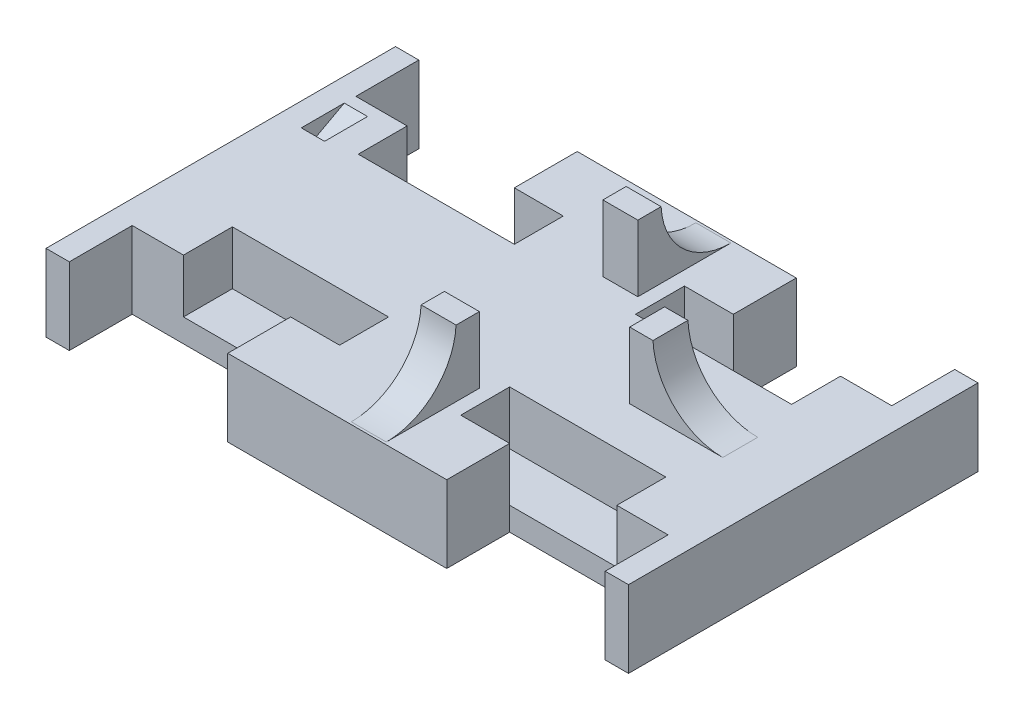
from build123d import *

# Parameters (mm, degrees)
SKETCH2_W                = 10
SKETCH2_H                = 86
BOSS_EXTRUDE1_DEPTH      = 10
SKETCH3_W                = 10
SKETCH3_H                = 86
BOSS_EXTRUDE2_DEPTH      = 23
BOSS_EXTRUDE3_REACH      = 246.16
BOSS_EXTRUDE4_DEPTH      = 100
BOSS_EXTRUDE4_DEPTH_BACK = 5
SKETCH5_R                = 47.55
SKETCH7_W                = 10
SKETCH7_H                = 18.447060317
BOSS_EXTRUDE6_DEPTH      = 30
CUT_EXTRUDE2_DEPTH       = 10
BOSS_EXTRUDE7_REACH      = 275.742
SKETCH6_R                = 45.55
CUT_EXTRUDE1_DEPTH       = 100
SKETCH10_W               = 15
SKETCH10_H               = 10
SKETCH10_W_2             = 10
SKETCH10_H_2             = 15
BOSS_EXTRUDE8_DEPTH      = 28.5
FILLET1_R                = 30
FILLET2_R                = 30
FILLET3_R                = 30
SKETCH11_W               = 111.971085125
SKETCH11_H               = 99.425275067
CUT_EXTRUDE3_DEPTH       = 234.52646531


with BuildPart() as part:
    # Sketch2 → Boss-Extrude1 (new body)
    with BuildSketch(Plane(origin=(0, 0, 0), x_dir=(1, 0, 0), z_dir=(0, 1, 0))):
        Polygon((-125, -75), (-115, -75), (-115, -48), (-47, -48), (-47, -75), (47, -75), (47, -48), (115, -48), (115, -75), (125, -75), (125, 75), (115, 75), (115, 48), (47, 48), (47, 75), (-47, 75), (-47, 48), (-115, 48), (-115, 75), (-125, 75), align=None)
        with Locations((-110, 0)):
            Rectangle(SKETCH2_W, SKETCH2_H, mode=Mode.SUBTRACT)
    extrude(amount=BOSS_EXTRUDE1_DEPTH)

    # Sketch3 → Boss-Extrude2 (add)
    with BuildSketch(Plane(origin=(0, 10, 0), x_dir=(1, 0, 0), z_dir=(0, 1, 0))):
        Polygon((-47, 48), (-47, 75), (47, 75), (47, 48), (26, 48), (26, 27), (93, 27), (93, 48), (115, 48), (115, 75), (125, 75), (125, -75), (115, -75), (115, -48), (93, -48), (93, -27), (26, -27), (26, -48), (47, -48), (47, -75), (-47, -75), (-47, -48), (-26, -48), (-26, -27), (-93, -27), (-93, -48), (-115, -48), (-115, -75), (-125, -75), (-125, 75), (-115, 75), (-115, 48), (-93, 48), (-93, 27), (-26, 27), (-26, 48), align=None)
        with Locations((-110, 0)):
            Rectangle(SKETCH3_W, SKETCH3_H, mode=Mode.SUBTRACT)
    extrude(amount=BOSS_EXTRUDE2_DEPTH)

    # Sketch4 → Boss-Extrude3 (add, up to next)
    with BuildSketch(Plane.ZY.offset(105), mode=Mode.PRIVATE) as boss_extrude3_sk1:
        Polygon((-43, 0), (-9.223530158, 14.703891082), (-43, 33), align=None)
    boss_extrude3_tool1 = extrude(boss_extrude3_sk1.sketch, amount=BOSS_EXTRUDE3_REACH, mode=Mode.PRIVATE) - part.part
    # Sketch4 → Boss-Extrude3 (add, up to next)
    with BuildSketch(Plane.ZY.offset(105), mode=Mode.PRIVATE) as boss_extrude3_sk2:
        Polygon((43, 0), (9.223530158, 14.703891082), (-24.552939683, 33), (43, 33), align=None)
    boss_extrude3_tool2 = extrude(boss_extrude3_sk2.sketch, amount=BOSS_EXTRUDE3_REACH, mode=Mode.PRIVATE) - part.part
    add(boss_extrude3_tool1.solids().sort_by_distance((-105, 15.901297, -31.741177))[0])
    add(boss_extrude3_tool2.solids().sort_by_distance((-105, 21.685197, 19.901194))[0])



with BuildPart() as body_2:
    # Sketch5 → Boss-Extrude4 (new, two sides: drawn at the far end of the back side and taken through both)
    with BuildSketch(Plane(origin=(-115, 0, 0), x_dir=(0, 0, -1), z_dir=(1, 0, 0)).offset(-BOSS_EXTRUDE4_DEPTH_BACK)):
        with Locations((0, 80.55)):
            Circle(SKETCH5_R)
    extrude(amount=BOSS_EXTRUDE4_DEPTH + BOSS_EXTRUDE4_DEPTH_BACK)


with BuildPart() as part_1:
    add(part.part)

    add(body_2.part)  # Boss-Extrude6 merges body 2
    # Sketch7 → Boss-Extrude6 (add)
    with BuildSketch(Plane(origin=(0, 33, 0), x_dir=(1, 0, 0), z_dir=(0, 1, 0))):
        Polygon((-120, 0), (-120, 48), (-93, 48), (-93, 27), (-15, 27), (-15, -27), (-93, -27), (-93, -48), (-120, -48), align=None)
        with Locations((-110, 33.776469842)):
            Rectangle(SKETCH7_W, SKETCH7_H, mode=Mode.SUBTRACT)
    extrude(amount=BOSS_EXTRUDE6_DEPTH)

    # Sketch8 → Cut-Extrude2 (cut)
    with BuildSketch(Plane.ZY.offset(105)):
        Polygon((-43, 46.626077643), (-41.871641374, 62.212018017), (-24.552939683, 62.212018017), (-24.552939683, 33), (-43, 33), align=None)
    extrude(amount=CUT_EXTRUDE2_DEPTH, mode=Mode.SUBTRACT)

    # Sketch9 → Boss-Extrude7 (add, up to next)
    with BuildSketch(Plane.ZY.offset(105), mode=Mode.PRIVATE) as boss_extrude7_sk1:
        Polygon((-42.138917347, 58.520153318), (-43, 46.626077643), (-43, 62.212018017), (-41.871641374, 62.212018017), align=None)
    boss_extrude7_tool1 = extrude(boss_extrude7_sk1.sketch, amount=BOSS_EXTRUDE7_REACH, mode=Mode.PRIVATE) - part_1.part
    add(boss_extrude7_tool1.solids().sort_by_distance((-105, 57.016705, -42.62388))[0])

    # Sketch6 → Cut-Extrude1 (cut)
    with BuildSketch(Plane(origin=(-15, 0, 0), x_dir=(0, 0, -1), z_dir=(1, 0, 0))):
        with Locations((0, 80.55)):
            Circle(SKETCH6_R)
    extrude(amount=-CUT_EXTRUDE1_DEPTH, mode=Mode.SUBTRACT)

    # Sketch10 → Boss-Extrude8 (add)
    with BuildSketch(Plane(origin=(0, 33, 0), x_dir=(1, 0, 0), z_dir=(0, 1, 0))):
        with Locations((12.5, 39)):
            Rectangle(SKETCH10_W, SKETCH10_H)
        with Locations((12.5, -39)):
            Rectangle(SKETCH10_W, SKETCH10_H)
        with Locations((63, 0)):
            Rectangle(SKETCH10_W_2, SKETCH10_H_2)
    extrude(amount=BOSS_EXTRUDE8_DEPTH)

    # Fillet1
    # the kernel refuses this fillet: 30 mm, written as the material it adds along each edge
    with BuildSketch(Plane(origin=(5, 33, 44), x_dir=(0, 0, 1), z_dir=(1, 0, 0))) as fillet1_piece_1:
        with BuildLine():
            CenterArc((29.962476533, -30), FILLET1_R, 90, 87.134016017)
            Line((0, -28.5), (0, 0))
            Line((0, 0), (29.962476533, 0))
        make_face()
    extrude(amount=15)

    # Fillet2
    # the kernel refuses this fillet: 30 mm, written as the material it adds along each edge
    with BuildSketch(Plane(origin=(20, 33, -44), x_dir=(0, 0, -1), z_dir=(-1, 0, 0))) as fillet2_piece_1:
        with BuildLine():
            CenterArc((29.962476533, -30), FILLET2_R, 90, 87.134016017)
            Line((0, -28.5), (0, 0))
            Line((0, 0), (29.962476533, 0))
        make_face()
    extrude(amount=15)

    # Fillet3
    # the kernel refuses this fillet: 30 mm, written as the material it adds along each edge
    with BuildSketch(Plane(origin=(68, 33, 7.5), x_dir=(1, 0, 0), z_dir=(0, 0, -1))) as fillet3_piece_1:
        with BuildLine():
            CenterArc((29.962476533, -30), FILLET3_R, 90, 87.134016017)
            Line((0, -28.5), (0, 0))
            Line((0, 0), (29.962476533, 0))
        make_face()
    extrude(amount=15)

    # Sketch11 → Cut-Extrude3 (cut, through all)
    with BuildSketch(Plane.XY.offset(75)):
        with Locations((-64.014457438, 82.712637534)):
            Rectangle(SKETCH11_W, SKETCH11_H)
    extrude(amount=-CUT_EXTRUDE3_DEPTH, mode=Mode.SUBTRACT)


solid = part_1.part
